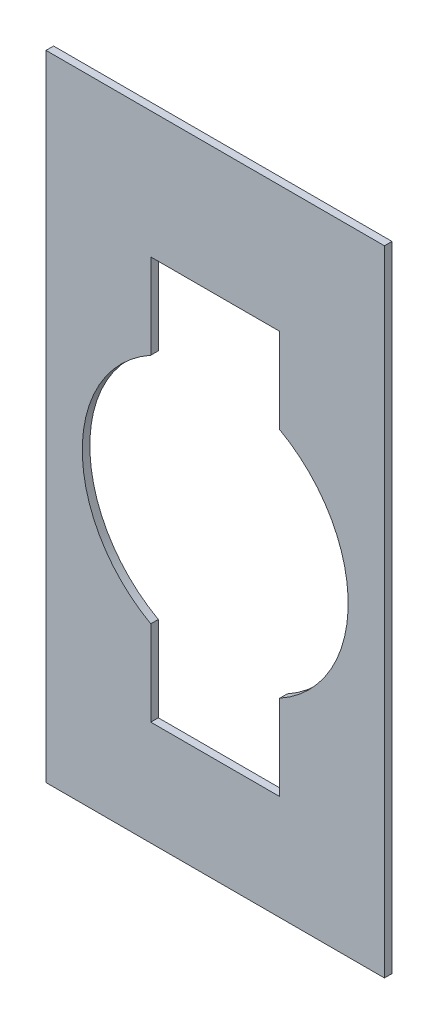
from build123d import *

# Parameters (mm, degrees)
SKETCH2_W           = 533.4
SKETCH2_H           = 999.49
BOSS_EXTRUDE1_DEPTH = 11.90625


with BuildPart() as part:
    # Sketch2 → Boss-Extrude1 (new body)
    with BuildSketch(Plane.XY):
        with Locations((126.463380282, 187.879507042)):
            Rectangle(SKETCH2_W, SKETCH2_H)
        with BuildLine():
            Line((24.863380282, 488.234507042), (228.063380282, 488.234507042))
            Line((228.063380282, 488.234507042), (228.063380282, 354.006552101))
            ThreePointArc((228.063380282, 354.006552101), (336.013380282, 170.734507042), (228.063380282, -12.537538016))
            Line((228.063380282, -12.537538016), (228.063380282, -146.765492958))
            Line((228.063380282, -146.765492958), (24.863380282, -146.765492958))
            Line((24.863380282, -146.765492958), (24.863380282, -12.537538016))
            ThreePointArc((24.863380282, -12.537538016), (-83.086619718, 170.734507042), (24.863380282, 354.006552101))
            Line((24.863380282, 354.006552101), (24.863380282, 488.234507042))
        make_face(mode=Mode.SUBTRACT)
    extrude(amount=BOSS_EXTRUDE1_DEPTH)


solid = part.part
